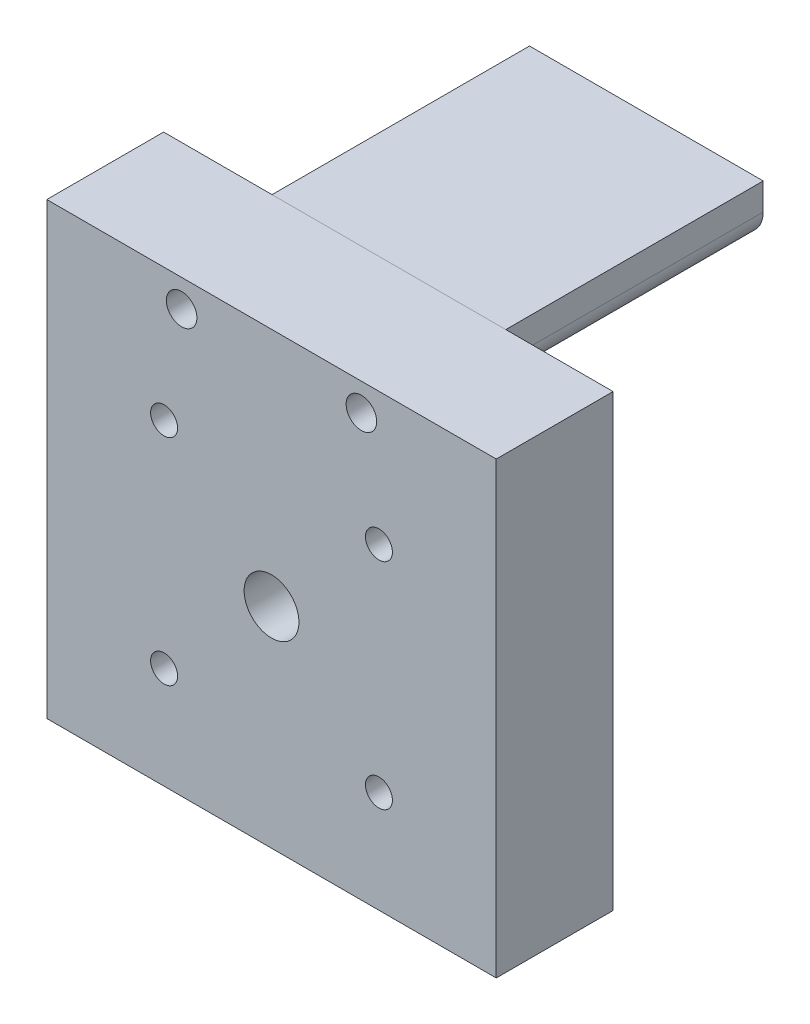
from build123d import *

# Parameters (mm, degrees)
SKETCH1_W           = 26
SKETCH1_H           = 6
BOSS_EXTRUDE1_DEPTH = 28.7
SKETCH4_R           = 1.7
CUT_EXTRUDE2_DEPTH  = 9
SKETCH8_R           = 1.7
CUT_EXTRUDE4_DEPTH  = 32.649486568
FILLET2_R           = 3
SKETCH9_R           = 22.5
CUT_EXTRUDE5_DEPTH  = 45
SKETCH_2_W          = 50
SKETCH_2_H          = 50
SKETCH_2_R          = 1.5
SKETCH_2_R_2        = 1.7
EXTRUDE_2_DEPTH     = 13


with BuildPart() as part:
    # Sketch1 → Boss-Extrude1 (new body)
    with BuildSketch(Plane.XY):
        Rectangle(SKETCH1_W, SKETCH1_H)
    extrude(amount=BOSS_EXTRUDE1_DEPTH)

    # Sketch4 → Cut-Extrude2 (cut)
    with BuildSketch(Plane(origin=(0, 0, 0), x_dir=(-1, 0, 0), z_dir=(0, 0, -1))):
        with Locations((-15, 0)):
            Circle(SKETCH4_R)
        with Locations((10, 0)):
            Circle(SKETCH4_R)
    extrude(amount=-CUT_EXTRUDE2_DEPTH, mode=Mode.SUBTRACT)

    # Sketch8 → Cut-Extrude4 (cut, through all)
    with BuildSketch(Plane.XY.offset(28.7)):
        with Locations((-10, 0)):
            Circle(SKETCH8_R)
        with Locations((10, 0)):
            Circle(SKETCH8_R)
    extrude(amount=-CUT_EXTRUDE4_DEPTH, mode=Mode.SUBTRACT)

    # Fillet2
    fillet2_edges = [part.edges().sort_by_distance(p)[0] for p in [
        (13, -3, 14.35),
        (-13, -3, 14.35),
    ]]
    fillet(fillet2_edges, radius=FILLET2_R)

    # Sketch9 → Cut-Extrude5 (cut)
    with BuildSketch(Plane(origin=(0, 0, 0), x_dir=(-1, 0, 0), z_dir=(0, 0, -1))):
        with Locations((0, -23)):
            Circle(SKETCH9_R)
    extrude(amount=-CUT_EXTRUDE5_DEPTH, mode=Mode.SUBTRACT)

    # 草图2 → 凸台-拉伸2 (add)
    with BuildSketch(Plane.XY.offset(28.7)):
        with Locations((0, -21.940687277)):
            Rectangle(SKETCH_2_W, SKETCH_2_H)
        with Locations((-11.95, -35.590687277)):
            Circle(SKETCH_2_R, mode=Mode.SUBTRACT)
        with BuildLine():
            ThreePointArc((3.05, -23.640687277), (0, -26.690687277), (-3.05, -23.640687277))
            ThreePointArc((-3.05, -23.640687277), (0, -20.590687277), (3.05, -23.640687277))
        make_face(mode=Mode.SUBTRACT)
        with Locations((11.95, -35.590687277)):
            Circle(SKETCH_2_R, mode=Mode.SUBTRACT)
        with Locations((-11.95, -11.690687277)):
            Circle(SKETCH_2_R, mode=Mode.SUBTRACT)
        with Locations((11.95, -11.690687277)):
            Circle(SKETCH_2_R, mode=Mode.SUBTRACT)
        with Locations((-10, 0)):
            Circle(SKETCH_2_R_2, mode=Mode.SUBTRACT)
        with Locations((10, 0)):
            Circle(SKETCH_2_R_2, mode=Mode.SUBTRACT)
    extrude(amount=EXTRUDE_2_DEPTH)


solid = part.part
